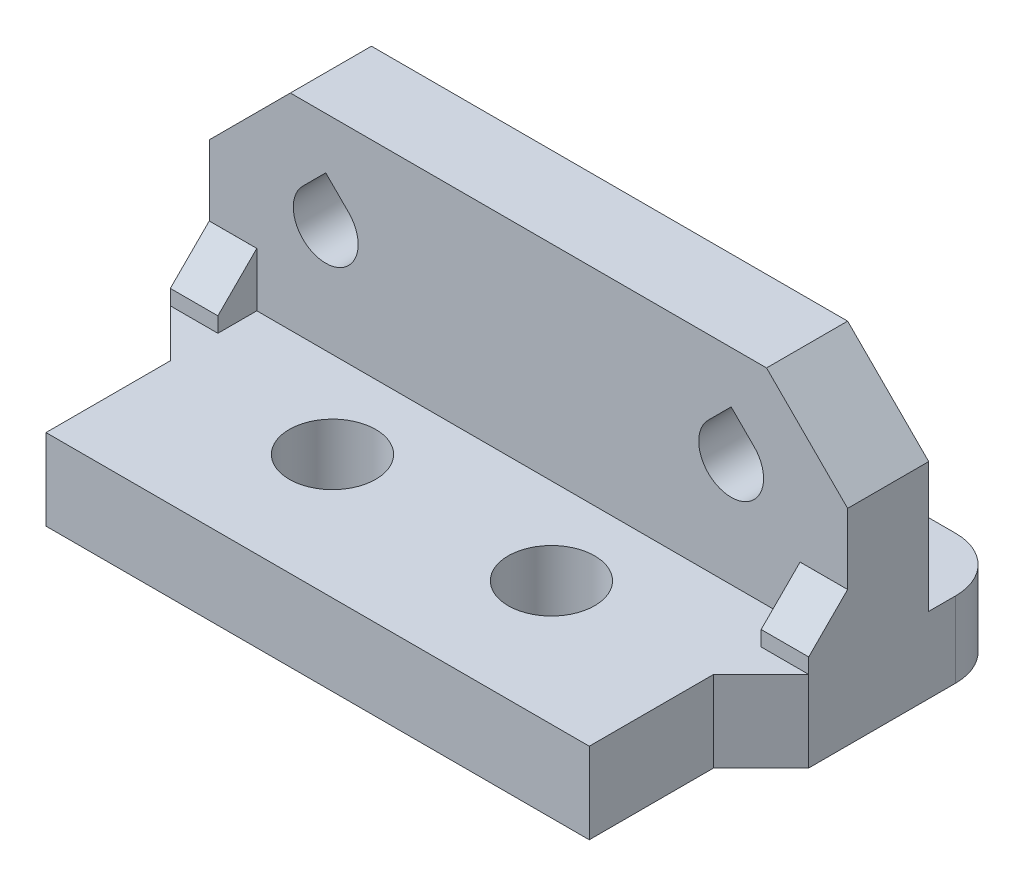
from build123d import *

# Parameters (mm, degrees)
SKETCH1_R               = 3.2
BOSS_EXTRUDE1_DEPTH     = 3
SKETCH1_3_R             = 3.2
SKETCH1_3_R_2           = 1.6
BOSS_EXTRUDE2_DEPTH     = 3
BOSS_EXTRUDE3_OUTLINE_W = 23.618802154
BOSS_EXTRUDE3_OUTLINE_H = 3
BOSS_EXTRUDE3_DEPTH     = 10.6
SKETCH3_R               = 1.2
CUT_EXTRUDE4_DEPTH      = 3
SKETCH1_7_W             = 1.759401077
SKETCH1_7_H             = 1.440598923
BOSS_EXTRUDE5_DEPTH     = 5
CHAMFER1_SIZE           = 1.44
CHAMFER2_SIZE           = 3
BOSS_EXTRUDE6_DEPTH     = 2.8
FILLET1_R               = 2


# Read off the part's stored shape, not the designer's step: Boss-Extrude3
with BuildPart() as part:
    # Sketch1 → Boss-Extrude1 (new body)
    with BuildSketch(Plane(origin=(0, 0, 0), x_dir=(1, 0, 0), z_dir=(0, 1, 0))):
        Polygon((11.809401077, 3.2), (10.05, 3.2), (10.05, 6.2), (-10.05, 6.2), (-10.05, 3.2), (-11.809401077, 3.2), (-11.809401077, 1.759401077), (-10.05, 0), (-10.05, -4.6), (10.05, -4.6), (10.05, 0), (11.809401077, 1.759401077), align=None)
        with Locations(Location((-4.05, 0, 0), (0, 0, 270))):
            Circle(SKETCH1_R, mode=Mode.SUBTRACT)
        with Locations(Location((4.05, 0, 0), (0, 0, 270))):
            Circle(SKETCH1_R, mode=Mode.SUBTRACT)
    extrude(amount=BOSS_EXTRUDE1_DEPTH)

    # Sketch1<3> → Boss-Extrude2 (add)
    # profile 1 of 2: a face of its own
    with BuildSketch(Plane(origin=(0, 0, 0), x_dir=(1, 0, 0), z_dir=(0, 1, 0))):
        with Locations((-4.05, 0)):
            Circle(SKETCH1_3_R)
        with Locations(Location((-4.05, 0, 0), (0, 0, 270))):
            Circle(SKETCH1_3_R_2, mode=Mode.SUBTRACT)
    # profile 2 of 2: a face of its own
    with BuildSketch(Plane(origin=(0, 0, 0), x_dir=(1, 0, 0), z_dir=(0, 1, 0))):
        with Locations((4.05, 0)):
            Circle(SKETCH1_3_R)
        with Locations(Location((4.05, 0, 0), (0, 0, 270))):
            Circle(SKETCH1_3_R_2, mode=Mode.SUBTRACT)
    extrude(amount=BOSS_EXTRUDE2_DEPTH)

    # Boss-Extrude3 outline → Boss-Extrude3 (add)
    with BuildSketch(Plane(origin=(0, 0, 0), x_dir=(1, 0, 0), z_dir=(0, 1, 0))):
        with Locations((0, 4.7)):
            Rectangle(BOSS_EXTRUDE3_OUTLINE_W, BOSS_EXTRUDE3_OUTLINE_H)
    extrude(amount=BOSS_EXTRUDE3_DEPTH)

    # Sketch3 → Cut-Extrude4 (cut)
    with BuildSketch(Plane(origin=(0, 0, -6.2), x_dir=(-1, 0, 0), z_dir=(0, 0, -1))):
        with Locations((-7.5, 7)):
            Circle(SKETCH3_R)
        with Locations((7.5, 7)):
            Circle(SKETCH3_R)
        with BuildLine():
            Line((-6.651471863, 7.848528137), (-7.5, 8.697056275))
            Line((-7.5, 8.697056275), (-8.348528137, 7.848528137))
            ThreePointArc((-8.348528137, 7.848528137), (-7.5, 8.2), (-6.651471863, 7.848528137))
        make_face()
        with BuildLine():
            Line((8.348528137, 7.848528137), (7.5, 8.697056275))
            Line((7.5, 8.697056275), (6.651471863, 7.848528137))
            ThreePointArc((6.651471863, 7.848528137), (7.5, 8.2), (8.348528137, 7.848528137))
        make_face()
    extrude(amount=-CUT_EXTRUDE4_DEPTH, mode=Mode.SUBTRACT)

    # Sketch1<7> → Boss-Extrude5 (add)
    with BuildSketch(Plane(origin=(0, 0, 0), x_dir=(1, 0, 0), z_dir=(0, 1, 0))):
        with Locations((-10.929700539, 2.479700539)):
            Rectangle(SKETCH1_7_W, SKETCH1_7_H)
        with Locations((10.929700539, 2.479700539)):
            Rectangle(SKETCH1_7_W, SKETCH1_7_H)
    extrude(amount=BOSS_EXTRUDE5_DEPTH)

    # Chamfer1
    chamfer1_edges = [part.edges().sort_by_distance(p)[0] for p in [
        (-10.929700538, 5, -1.759401077),
        (10.929700538, 5, -1.759401077),
    ]]
    chamfer(chamfer1_edges, length=CHAMFER1_SIZE)

    # Chamfer2
    chamfer2_edges = [part.edges().sort_by_distance(p)[0] for p in [
        (-11.809401077, 10.6, -4.7),
        (11.809401077, 10.6, -4.7),
    ]]
    chamfer(chamfer2_edges, length=CHAMFER2_SIZE)

    # Sketch1<8> → Boss-Extrude6 (add)
    with BuildSketch(Plane(origin=(0, 0, 0), x_dir=(1, 0, 0), z_dir=(0, 1, 0))):
        Polygon((-11.809401077, 9.2), (-11.809401077, 6.2), (-10.05, 6.2), (10.05, 6.2), (11.809401077, 6.2), (11.809401077, 9.2), align=None)
    extrude(amount=BOSS_EXTRUDE6_DEPTH)

    # Fillet1
    fillet1_edges = [part.edges().sort_by_distance(p)[0] for p in [
        (11.809401077, 1.4, -9.2),
        (-11.809401077, 1.4, -9.2),
    ]]
    fillet(fillet1_edges, radius=FILLET1_R)


solid = part.part
